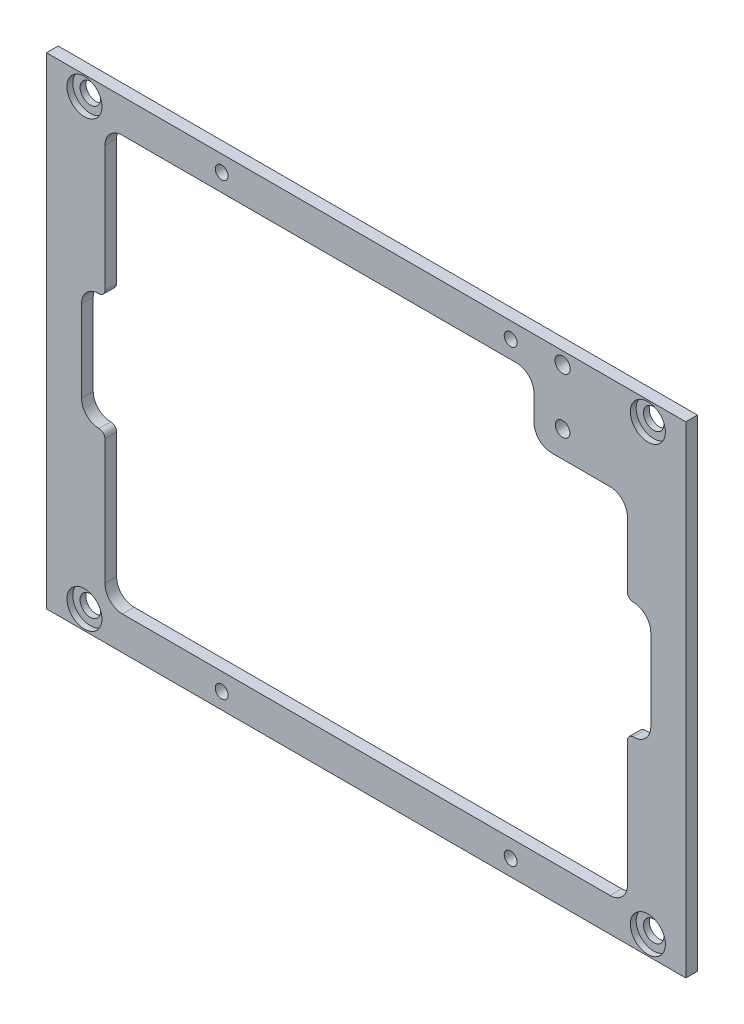
from build123d import *

# Parameters (mm, degrees)
SKETCH1_W                  = 109.5
SKETCH1_H                  = 82.5
BOSS_EXTRUDE1_DEPTH        = 2
F_3_5_3_5_DIAMETER_HOLE1_D = 3.5
F_2_5_2_5_DIAMETER_HOLE1_D = 2.5
F_2_6_2_6_DIAMETER_HOLE1_D = 2.6
SKETCH9_R                  = 3
CUT_EXTRUDE1_DEPTH         = 1
F_2_2_2_2_DIAMETER_HOLE1_D = 2.2
FILLET1_R                  = 1
FILLET2_R                  = 3


with BuildPart() as part:
    # Sketch1 → Boss-Extrude1 (new body)
    with BuildSketch(Plane.XY):
        with Locations((0, -41.75)):
            Rectangle(SKETCH1_W, SKETCH1_H)
        with BuildLine():
            Line((28.75, -9.25), (28.75, -13.6))
            ThreePointArc((28.75, -13.6), (29.628679656, -15.721320344), (31.75, -16.6))
            Line((31.75, -16.6), (41.75, -16.6))
            ThreePointArc((41.75, -16.6), (43.871320344, -17.478679656), (44.75, -19.6))
            Line((44.75, -19.6), (44.75, -31.75))
            Line((44.75, -31.75), (48.75, -31.75))
            Line((48.75, -31.75), (48.75, -41.75))
            Line((48.75, -41.75), (48.75, -51.75))
            Line((48.75, -51.75), (44.75, -51.75))
            Line((44.75, -51.75), (44.75, -74.25))
            ThreePointArc((44.75, -74.25), (43.871320344, -76.371320344), (41.75, -77.25))
            Line((41.75, -77.25), (-41.75, -77.25))
            ThreePointArc((-41.75, -77.25), (-43.871320344, -76.371320344), (-44.75, -74.25))
            Line((-44.75, -74.25), (-44.75, -51.75))
            Line((-44.75, -51.75), (-48.75, -51.75))
            Line((-48.75, -51.75), (-48.75, -31.75))
            Line((-48.75, -31.75), (-44.75, -31.75))
            Line((-44.75, -31.75), (-44.75, -9.25))
            ThreePointArc((-44.75, -9.25), (-43.871320344, -7.128679656), (-41.75, -6.25))
            Line((-41.75, -6.25), (25.75, -6.25))
            ThreePointArc((25.75, -6.25), (27.871320344, -7.128679656), (28.75, -9.25))
        make_face(mode=Mode.SUBTRACT)
    extrude(amount=BOSS_EXTRUDE1_DEPTH)

    # Ø3.5 (3.5) Diameter Hole1 (through all)
    with Locations(Plane.XY.offset(2)):
        with Locations((-48.25, -3.75), (-48.25, -79.75), (48.25, -79.75), (48.25, -3.75)):
            Hole(F_3_5_3_5_DIAMETER_HOLE1_D / 2)

    # Ø2.5 (2.5) Diameter Hole1 (through all)
    with Locations(Plane.XY.offset(2)):
        with Locations((33.65, -12.1)):
            Hole(F_2_5_2_5_DIAMETER_HOLE1_D / 2)

    # Ø2.6 (2.6) Diameter Hole1 (through all)
    with Locations(Plane.XY.offset(2)):
        with Locations((33.65, -2.57)):
            Hole(F_2_6_2_6_DIAMETER_HOLE1_D / 2)

    # Sketch9 → Cut-Extrude1 (cut)
    with BuildSketch(Plane.XY.offset(2)):
        with Locations((-48.25, -3.75)):
            Circle(SKETCH9_R)
        with Locations((48.25, -3.75)):
            Circle(SKETCH9_R)
        with Locations((48.25, -79.75)):
            Circle(SKETCH9_R)
        with Locations((-48.25, -79.75)):
            Circle(SKETCH9_R)
    extrude(amount=-CUT_EXTRUDE1_DEPTH, mode=Mode.SUBTRACT)

    # Ø2.2 (2.2) Diameter Hole1 (through all)
    with Locations(Plane.XY.offset(2)):
        with Locations((-24.75, -3.25), (24.75, -3.25), (-24.75, -80.25), (24.75, -80.25)):
            Hole(F_2_2_2_2_DIAMETER_HOLE1_D / 2)

    # Fillet1
    fillet1_edges = [part.edges().sort_by_distance(p)[0] for p in [
        (-44.75, -31.75, 1),
        (-44.75, -51.75, 1),
        (44.75, -51.75, 1),
        (44.75, -31.75, 1),
    ]]
    fillet(fillet1_edges, radius=FILLET1_R)

    # Fillet2
    fillet2_edges = [part.edges().sort_by_distance(p)[0] for p in [
        (48.75, -31.75, 1),
        (48.75, -51.75, 1),
        (-48.75, -51.75, 1),
        (-48.75, -31.75, 1),
    ]]
    fillet(fillet2_edges, radius=FILLET2_R - 0.0001)  # a hair under: the kernel refuses the full size


solid = part.part
